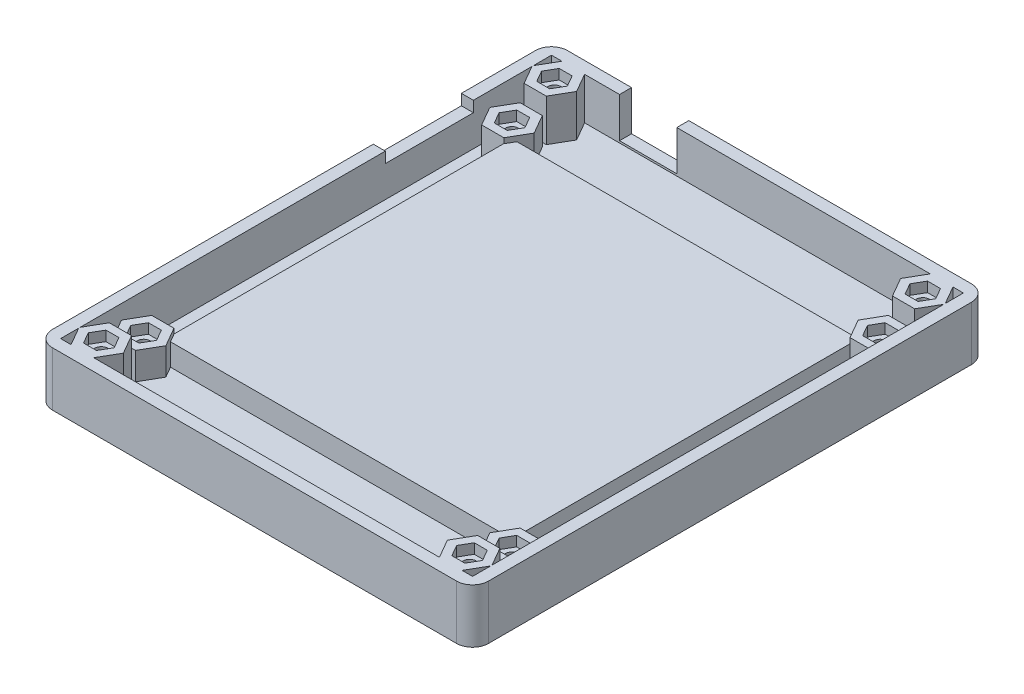
from build123d import *

# Parameters (mm, degrees)
P_IDAT_VYSUNUT_M25_DEPTH      = 3
P_IDAT_VYSUNUT_M26_DEPTH      = 10.5
P_IDAT_VYSUNUT_M26_DEPTH_BACK = 3
SKICA1_21_W                   = 108.885125168
SKICA1_21_H                   = 128.6
SKICA1_21_W_2                 = 102.885125168
SKICA1_21_H_2                 = 122.6
P_IDAT_VYSUNUT_M28_DEPTH      = 6.8
SKICA1_24_R                   = 1.6
P_IDAT_VYSUNUT_M29_DEPTH      = 4.3
LINPOLE3_COUNT                = 2
LINPOLE3_PITCH                = 92
LINPOLE3_COUNT_DIR2           = 2
LINPOLE3_PITCH_DIR2           = 92
P_IDAT_VYSUNUT_M30_DEPTH      = 10.5
SKICA1_26_R                   = 1.6
P_IDAT_VYSUNUT_M31_DEPTH      = 8
LINPOLE4_COUNT                = 2
LINPOLE4_PITCH                = 92
LINPOLE4_COUNT_DIR2           = 2
LINPOLE4_PITCH_DIR2           = 113.2
SKICA8_W                      = 86.538297386
SKICA8_H                      = 86.538297386
P_IDAT_VYSUNUT_M32_DEPTH      = 5.5
ZAOBLIT4_R                    = 4
SKICA9_W                      = 22
SKICA9_H                      = 2.7
ODEBRAT_VYSUNUT_M1_DEPTH      = 10
SKICA10_W                     = 14.3
SKICA10_H                     = 10
ODEBRAT_VYSUNUT_M2_DEPTH      = 5


with BuildPart() as part:
    # Skica1 → Přidat vysunutím25 (new body)
    with BuildSketch(Plane(origin=(0, 0, 0), x_dir=(1, 0, 0), z_dir=(0, 1, 0))):
        Polygon((51.442562584, 61.3), (-43.170983681, 61.3), (-43.228718708, 61.4), (-48.771281292, 61.4), (-48.829016319, 61.3), (-51.442562584, 61.3), (-51.442562584, 56.773205081), (-51.542562584, 56.6), (-51.442562584, 56.426794919), (-51.442562584, 46.173205081), (-51.542562584, 46), (-51.442562584, 45.826794919), (-51.442562584, -61.3), (51.442562584, -61.3), align=None)
    extrude(amount=-P_IDAT_VYSUNUT_M25_DEPTH)

    # Skica1<21> → Přidat vysunutím26 (add, two sides: drawn at the far end of the back side and taken through both)
    with BuildSketch(Plane(origin=(0, 0, 0), x_dir=(1, 0, 0), z_dir=(0, 1, 0)).offset(-P_IDAT_VYSUNUT_M26_DEPTH_BACK)):
        Rectangle(SKICA1_21_W, SKICA1_21_H)
        Rectangle(SKICA1_21_W_2, SKICA1_21_H_2, mode=Mode.SUBTRACT)
    extrude(amount=P_IDAT_VYSUNUT_M26_DEPTH + P_IDAT_VYSUNUT_M26_DEPTH_BACK)

    # Skica1<23> → Přidat vysunutím28 (add)
    with BuildSketch(Plane(origin=(0, 0, 0), x_dir=(1, 0, 0), z_dir=(0, 1, 0))):
        Polygon((-48.771281292, 41.2), (-43.228718708, 41.2), (-40.457437416, 46), (-43.228718708, 50.8), (-48.771281292, 50.8), (-51.542562584, 46), align=None)
        Polygon((-44.383419246, 43.2), (-47.616580754, 43.2), (-49.233161507, 46), (-47.616580754, 48.8), (-44.383419246, 48.8), (-42.766838493, 46), align=None, mode=Mode.SUBTRACT)
    p_idat_vysunut_m28 = extrude(amount=P_IDAT_VYSUNUT_M28_DEPTH)

    # Skica1<24> → Přidat vysunutím29 (add)
    with BuildSketch(Plane(origin=(0, 0, 0), x_dir=(1, 0, 0), z_dir=(0, 1, 0))):
        Polygon((-49.233161507, 46), (-47.616580754, 43.2), (-44.383419246, 43.2), (-42.766838493, 46), (-44.383419246, 48.8), (-47.616580754, 48.8), align=None)
        with Locations((-46, 46)):
            Circle(SKICA1_24_R, mode=Mode.SUBTRACT)
    p_idat_vysunut_m29 = extrude(amount=P_IDAT_VYSUNUT_M29_DEPTH)

    # LinPole3: Přidat vysunutím28, P_idat vysunut_m29 2 × 2
    with Locations(*[(i * LINPOLE3_PITCH, 0, j * LINPOLE3_PITCH_DIR2) for i in range(LINPOLE3_COUNT) for j in range(LINPOLE3_COUNT_DIR2) if (i, j) != (0, 0)]):
        add(p_idat_vysunut_m28)
        add(p_idat_vysunut_m29)

    # Skica1<25> → Přidat vysunutím30 (add)
    with BuildSketch(Plane(origin=(0, 0, 0), x_dir=(1, 0, 0), z_dir=(0, 1, 0))):
        Polygon((-51.542562584, 56.6), (-48.771281292, 51.8), (-43.228718708, 51.8), (-40.457437416, 56.6), (-43.228718708, 61.4), (-48.771281292, 61.4), align=None)
        Polygon((-44.383419246, 59.4), (-42.766838493, 56.6), (-44.383419246, 53.8), (-47.616580754, 53.8), (-49.233161507, 56.6), (-47.616580754, 59.4), align=None, mode=Mode.SUBTRACT)
    p_idat_vysunut_m30 = extrude(amount=P_IDAT_VYSUNUT_M30_DEPTH)

    # Skica1<26> → Přidat vysunutím31 (add)
    with BuildSketch(Plane(origin=(0, 0, 0), x_dir=(1, 0, 0), z_dir=(0, 1, 0))):
        Polygon((-44.383419246, 53.8), (-42.766838493, 56.6), (-44.383419246, 59.4), (-47.616580754, 59.4), (-49.233161507, 56.6), (-47.616580754, 53.8), align=None)
        with Locations((-46, 56.6)):
            Circle(SKICA1_26_R, mode=Mode.SUBTRACT)
    p_idat_vysunut_m31 = extrude(amount=P_IDAT_VYSUNUT_M31_DEPTH)

    # LinPole4: Přidat vysunutím30, P_idat vysunut_m31 2 × 2
    with Locations(*[(i * LINPOLE4_PITCH, 0, j * LINPOLE4_PITCH_DIR2) for i in range(LINPOLE4_COUNT) for j in range(LINPOLE4_COUNT_DIR2) if (i, j) != (0, 0)]):
        add(p_idat_vysunut_m30)
        add(p_idat_vysunut_m31)

    # Skica8 → Přidat vysunutím32 (add)
    with BuildSketch(Plane(origin=(0, 0, 0), x_dir=(1, 0, 0), z_dir=(0, 1, 0))):
        Rectangle(SKICA8_W, SKICA8_H)
    extrude(amount=P_IDAT_VYSUNUT_M32_DEPTH)

    # Zaoblit4
    zaoblit4_edges = [part.edges().sort_by_distance(p)[0] for p in [
        (-54.442562584, 3.75, 64.3),
        (54.442562584, 3.75, 64.3),
        (54.442562584, 3.75, -64.3),
        (-54.442562584, 3.75, -64.3),
    ]]
    fillet(zaoblit4_edges, radius=ZAOBLIT4_R)

    # Skica9 → Odebrat vysunutím1 (cut)
    with BuildSketch(Plane.ZY.offset(54.442562584)):
        with Locations((-30.8, 9.15)):
            Rectangle(SKICA9_W, SKICA9_H)
    extrude(amount=-ODEBRAT_VYSUNUT_M1_DEPTH, mode=Mode.SUBTRACT)

    # Skica10 → Odebrat vysunutím2 (cut)
    with BuildSketch(Plane(origin=(0, 0, -64.3), x_dir=(-1, 0, 0), z_dir=(0, 0, -1))):
        with Locations((27.292562584, 5.5)):
            Rectangle(SKICA10_W, SKICA10_H)
    extrude(amount=-ODEBRAT_VYSUNUT_M2_DEPTH, mode=Mode.SUBTRACT)


solid = part.part
